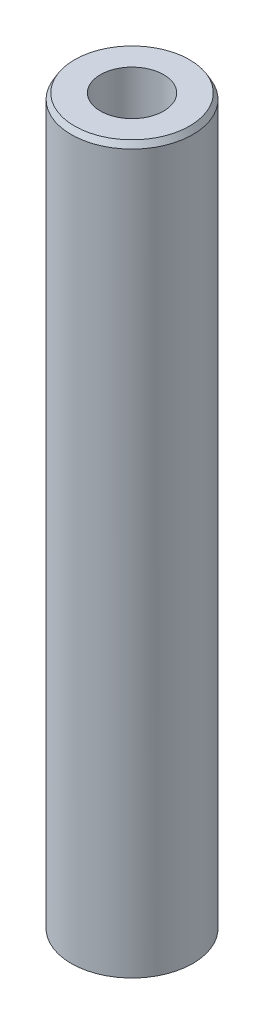
from build123d import *
from OCP.BRepFilletAPI import BRepFilletAPI_MakeChamfer

# Parameters (mm, degrees)
SKETCH1_R           = 35
BOSS_EXTRUDE1_DEPTH = 418.377284867
SKETCH2_R           = 18.189460704
CUT_EXTRUDE1_DEPTH  = 422.295089567
CHAMFER1_SIZE       = 3.295869752
CHAMFER1_SIZE2      = 1.902871288


with BuildPart() as part:
    # Sketch1 → Boss-Extrude1 (new body)
    with BuildSketch(Plane(origin=(0, 0, 0), x_dir=(1, 0, 0), z_dir=(0, 1, 0))):
        Circle(SKETCH1_R)
    extrude(amount=BOSS_EXTRUDE1_DEPTH)

    # Sketch2 → Cut-Extrude1 (cut, through all)
    with BuildSketch(Plane(origin=(0, 0, 0), x_dir=(1, 0, 0), z_dir=(0, 1, 0))):
        Circle(SKETCH2_R)
    extrude(amount=CUT_EXTRUDE1_DEPTH, mode=Mode.SUBTRACT)

    # Chamfer1: one chamfer whose edges measure the first distance from different faces: ONE call of the kernel's chamfer builder (chamfer() names one face for all edges)
    chamfer1_edges_1 = [part.edges().sort_by_distance(p)[0] for p in [
        (-35, 418.377284867, 0),
    ]]
    chamfer1_side_1 = [part.faces().sort_by_distance(p)[0] for p in [
        (-35, 209.188642434, 0),
    ]]
    chamfer1_edges_2 = [part.edges().sort_by_distance(p)[0] for p in [
        (-35, 0, 0),
    ]]
    chamfer1_side_2 = [part.faces().sort_by_distance(p)[0] for p in [
        (-34.010050506, 0, 0),
    ]]
    chamfer1 = BRepFilletAPI_MakeChamfer(part.part.solid().wrapped)
    for e in chamfer1_edges_1:
        chamfer1.Add(CHAMFER1_SIZE, CHAMFER1_SIZE2, e.wrapped, chamfer1_side_1[0].wrapped)  # the first distance lies on this face
    for e in chamfer1_edges_2:
        chamfer1.Add(CHAMFER1_SIZE, CHAMFER1_SIZE2, e.wrapped, chamfer1_side_2[0].wrapped)  # the first distance lies on this face
    add(Compound.cast(chamfer1.Shape()), mode=Mode.REPLACE)


solid = part.part
